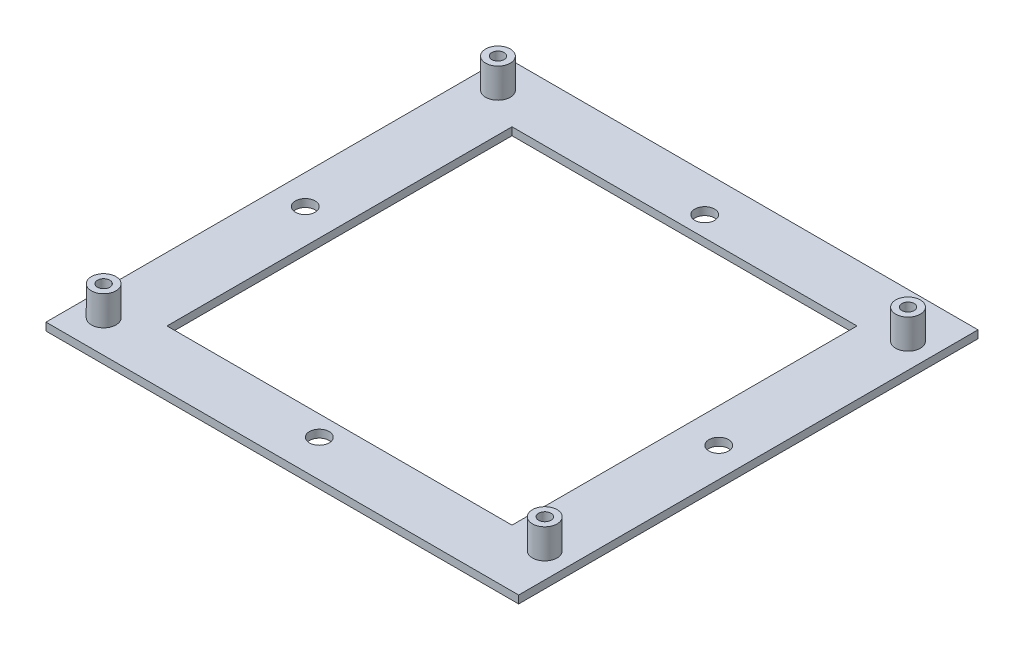
from build123d import *

# Parameters (mm, degrees)
SKETCH2_W                 = 95.9
SKETCH2_H                 = 93.2
SKETCH2_R                 = 2
SKETCH2_W_2               = 70
SKETCH2_H_2               = 70
BOSS_EXTRUDE1_DEPTH       = 1.58
SKETCH3_R                 = 2.5
BOSS_EXTRUDE2_DEPTH       = 6
M3X0_5_TAPPED_HOLE1_D     = 2.5
M3X0_5_TAPPED_HOLE1_DEPTH = 6
M3X0_5_TAPPED_HOLE1_TIP   = 0.751075774


with BuildPart() as part:
    # Sketch2 → Boss-Extrude1 (new body)
    with BuildSketch(Plane(origin=(0, 0, 0), x_dir=(1, 0, 0), z_dir=(0, 1, 0))):
        Rectangle(SKETCH2_W, SKETCH2_H)
        with Locations((0, 39.1)):
            Circle(SKETCH2_R, mode=Mode.SUBTRACT)
        with Locations((41.95, 0)):
            Circle(SKETCH2_R, mode=Mode.SUBTRACT)
        with Locations((-41.95, 0)):
            Circle(SKETCH2_R, mode=Mode.SUBTRACT)
        with Locations((0, -39.1)):
            Circle(SKETCH2_R, mode=Mode.SUBTRACT)
        Rectangle(SKETCH2_W_2, SKETCH2_H_2, mode=Mode.SUBTRACT)
    extrude(amount=BOSS_EXTRUDE1_DEPTH)

    # Sketch3 → Boss-Extrude2 (add)
    with BuildSketch(Plane(origin=(0, 1.58, 0), x_dir=(1, 0, 0), z_dir=(0, 1, 0))):
        with Locations((-42.85, 40)):
            Circle(SKETCH3_R)
        with Locations((42.85, 37.5)):
            Circle(SKETCH3_R)
        with Locations((-42.85, -40)):
            Circle(SKETCH3_R)
        with Locations((42.85, -36.2)):
            Circle(SKETCH3_R)
    extrude(amount=BOSS_EXTRUDE2_DEPTH)

    # M3x0.5 Tapped Hole1
    with Locations(Plane(origin=(-42.85, 7.58, -40), x_dir=(0, 0, 1), z_dir=(0, 1, 0))):
        with Locations((0, 0), (80, 0), (76.2, 85.7), (2.5, 85.7)):
            Hole(M3X0_5_TAPPED_HOLE1_D / 2, depth=M3X0_5_TAPPED_HOLE1_DEPTH)
            with Locations((0, 0, -(M3X0_5_TAPPED_HOLE1_DEPTH + M3X0_5_TAPPED_HOLE1_TIP / 2))):  # 118° drill point
                Cone(0, M3X0_5_TAPPED_HOLE1_D / 2, M3X0_5_TAPPED_HOLE1_TIP, mode=Mode.SUBTRACT)


solid = part.part
